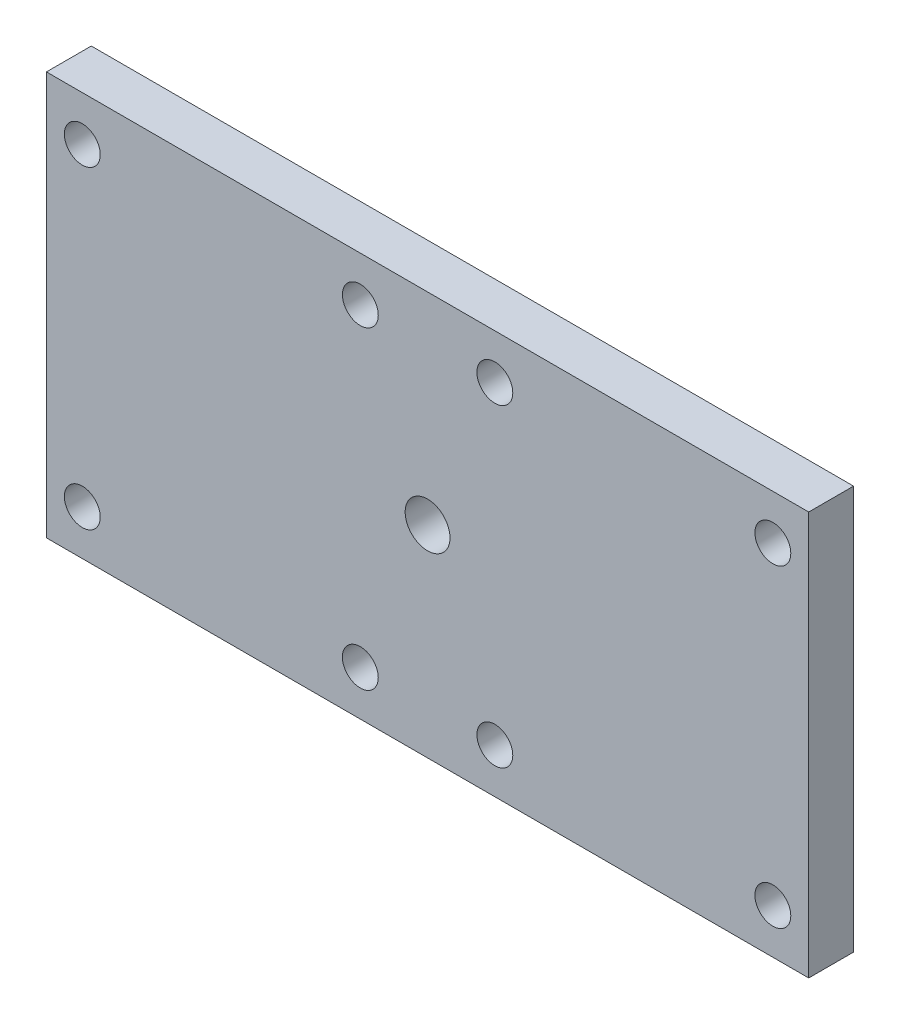
from build123d import *

# Parameters (mm, degrees)
SKETCH1_W                = 85
SKETCH1_H                = 45
BOSS_EXTRUDE1_DEPTH      = 5
CUT_EXTRUDE1_OUTLINE_R   = 2
CUT_EXTRUDE1_OUTLINE_R_2 = 2.5
CUT_EXTRUDE1_DEPTH       = 5


# Read off the part's stored shape, not the designer's step: Cut-Extrude1
with BuildPart() as part:
    # Sketch1 → Boss-Extrude1 (new body)
    with BuildSketch(Plane.XY):
        with Locations((-42.5, 22.5)):
            Rectangle(SKETCH1_W, SKETCH1_H)
    extrude(amount=BOSS_EXTRUDE1_DEPTH)

    # Cut-Extrude1 outline → Cut-Extrude1 (cut)
    with BuildSketch(Plane.XY):
        with Locations((-81, 40)):
            Circle(CUT_EXTRUDE1_OUTLINE_R)
        with Locations((-35, 5)):
            Circle(CUT_EXTRUDE1_OUTLINE_R)
        with Locations((-35, 40)):
            Circle(CUT_EXTRUDE1_OUTLINE_R)
        with Locations((-4, 40)):
            Circle(CUT_EXTRUDE1_OUTLINE_R)
        with Locations((-42.5, 22.5)):
            Circle(CUT_EXTRUDE1_OUTLINE_R_2)
        with Locations((-81, 5)):
            Circle(CUT_EXTRUDE1_OUTLINE_R)
        with Locations((-50, 5)):
            Circle(CUT_EXTRUDE1_OUTLINE_R)
        with Locations((-50, 40)):
            Circle(CUT_EXTRUDE1_OUTLINE_R)
        with Locations((-4, 5)):
            Circle(CUT_EXTRUDE1_OUTLINE_R)
    extrude(amount=CUT_EXTRUDE1_DEPTH, mode=Mode.SUBTRACT)


solid = part.part
